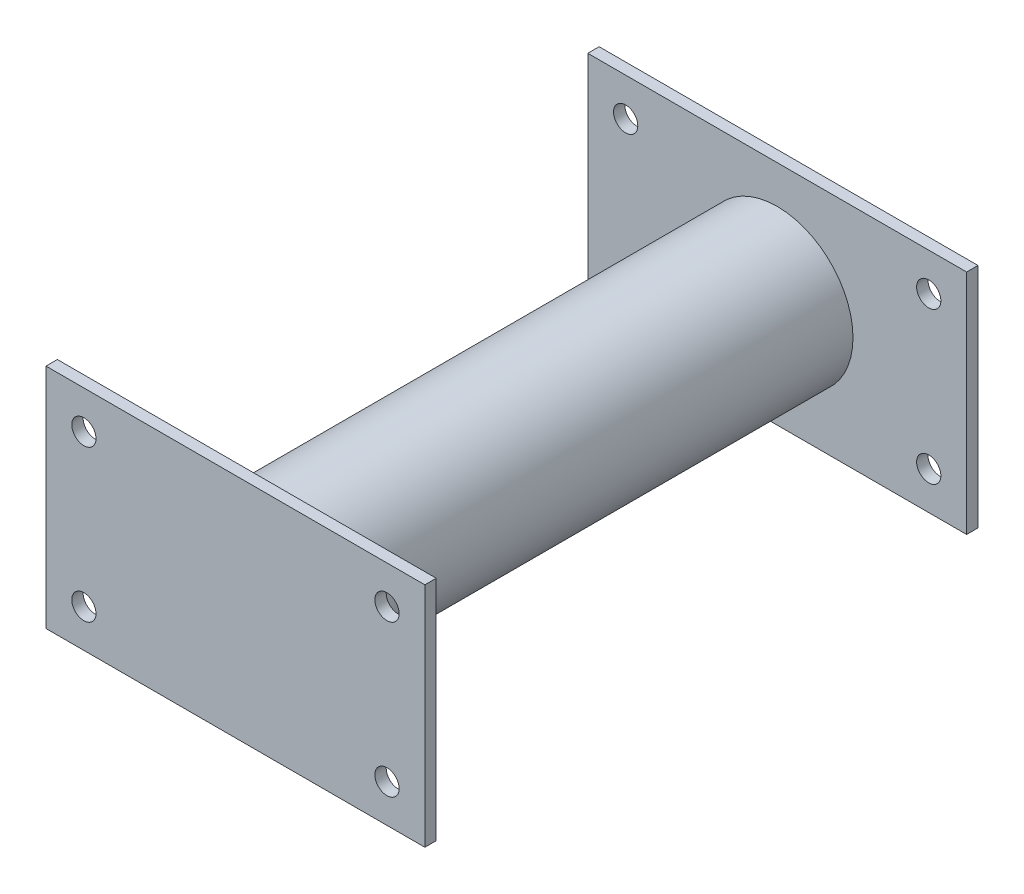
from build123d import *

# Parameters (mm, degrees)
SKETCH_1_W      = 50
SKETCH_1_H      = 30
SKETCH_1_R      = 1.6
EXTRUDE_1_DEPTH = 1.5
SKETCH_2_R      = 10
EXTRUDE_2_DEPTH = 70
SKETCH_5_W      = 50
SKETCH_5_H      = 30
SKETCH_5_R      = 1.6
EXTRUDE_3_DEPTH = 1.5


with BuildPart() as part:
    # 草圖1 → 填料-伸長1 (new body)
    with BuildSketch(Plane.XY):
        Rectangle(SKETCH_1_W, SKETCH_1_H)
        with Locations((-20, 10)):
            Circle(SKETCH_1_R, mode=Mode.SUBTRACT)
        with Locations((20, 10)):
            Circle(SKETCH_1_R, mode=Mode.SUBTRACT)
        with Locations((20, -10)):
            Circle(SKETCH_1_R, mode=Mode.SUBTRACT)
        with Locations((-20, -10)):
            Circle(SKETCH_1_R, mode=Mode.SUBTRACT)
    extrude(amount=EXTRUDE_1_DEPTH)

    # 草圖2 → 填料-伸長2 (add)
    with BuildSketch(Plane.XY.offset(1.5)):
        Circle(SKETCH_2_R)
    extrude(amount=EXTRUDE_2_DEPTH)

    # 草圖5 → 填料-伸長3 (add)
    with BuildSketch(Plane.XY.offset(71.5)):
        Rectangle(SKETCH_5_W, SKETCH_5_H)
        with Locations((20, 10)):
            Circle(SKETCH_5_R, mode=Mode.SUBTRACT)
        with Locations((20, -10)):
            Circle(SKETCH_5_R, mode=Mode.SUBTRACT)
        with Locations((-20, 10)):
            Circle(SKETCH_5_R, mode=Mode.SUBTRACT)
        with Locations((-20, -10)):
            Circle(SKETCH_5_R, mode=Mode.SUBTRACT)
    extrude(amount=EXTRUDE_3_DEPTH)


solid = part.part
